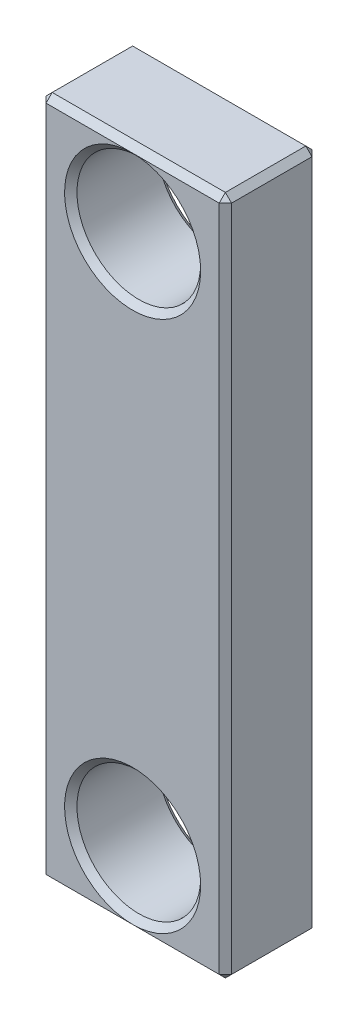
from build123d import *

# Parameters (mm, degrees)
SKETCH1_W           = 30
SKETCH1_H           = 110
SKETCH1_R           = 10
BOSS_EXTRUDE1_DEPTH = 15
CHAMFER1_SIZE       = 1


with BuildPart() as part:
    # Sketch1 → Boss-Extrude1 (new body)
    with BuildSketch(Plane.XY):
        Rectangle(SKETCH1_W, SKETCH1_H)
        with Locations((0, 43)):
            Circle(SKETCH1_R, mode=Mode.SUBTRACT)
        with Locations((0, -43)):
            Circle(SKETCH1_R, mode=Mode.SUBTRACT)
    extrude(amount=BOSS_EXTRUDE1_DEPTH)

    # Chamfer1
    chamfer1_edges = [part.edges().sort_by_distance(p)[0] for p in [
        (-15, 0, 15),
        (-10, 43, 0),
        (-10, 43, 15),
        (0, -55, 15),
        (-10, -43, 0),
        (-10, -43, 15),
        (15, 0, 15),
        (0, -55, 0),
        (-15, 0, 0),
        (0, 55, 0),
        (15, 0, 0),
        (0, 55, 15),
        (15, -55, 7.5),
        (-15, -55, 7.5),
        (-15, 55, 7.5),
        (15, 55, 7.5),
    ]]
    chamfer(chamfer1_edges, length=CHAMFER1_SIZE - 0.0001)  # a hair under: the kernel refuses the full size


solid = part.part
